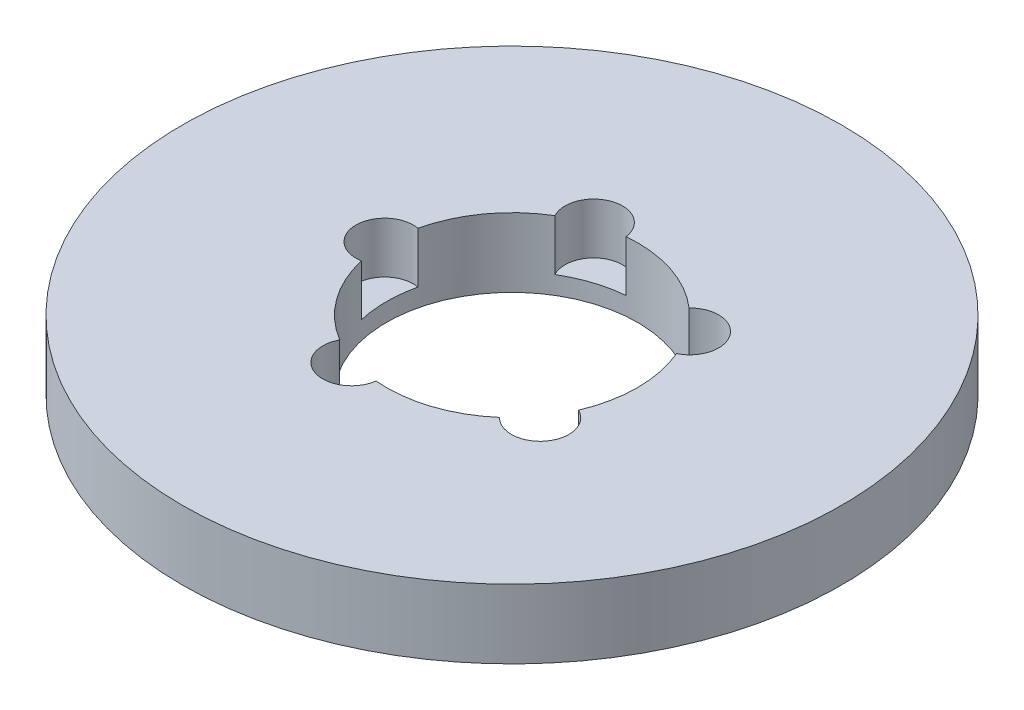
from build123d import *

# Parameters (mm, degrees)
SKETCH1_R           = 52.5
BOSS_EXTRUDE1_DEPTH = 11
SKETCH2_R           = 20
CUT_EXTRUDE1_DEPTH  = 76.056645275
SKETCH3_R           = 4.575923698
CUT_EXTRUDE2_DEPTH  = 8.123196128
CIRPATTERN1_COUNT   = 5


with BuildPart() as part:
    # Sketch1 → Boss-Extrude1 (new body)
    with BuildSketch(Plane(origin=(0, 0, 0), x_dir=(1, 0, 0), z_dir=(0, 1, 0))):
        Circle(SKETCH1_R)
    extrude(amount=BOSS_EXTRUDE1_DEPTH)

    # Sketch2 → Cut-Extrude1 (cut, through all)
    with BuildSketch(Plane(origin=(0, 0, 0), x_dir=(1, 0, 0), z_dir=(0, 1, 0))):
        Circle(SKETCH2_R)
    extrude(amount=CUT_EXTRUDE1_DEPTH, mode=Mode.SUBTRACT)

    # Sketch3 → Cut-Extrude2 (cut)
    with BuildSketch(Plane(origin=(0, 11, 0), x_dir=(1, 0, 0), z_dir=(0, 1, 0))):
        with Locations((-20.292409218, 0)):
            Circle(SKETCH3_R)
    cut_extrude2 = extrude(amount=-CUT_EXTRUDE2_DEPTH, mode=Mode.SUBTRACT)

    # CirPattern1: Cut-Extrude2 ×5 about axis
    cirpattern1_axis = Axis((0, 0, 0), (0, 1, 0))
    for i in range(1, CIRPATTERN1_COUNT):
        add(cut_extrude2.rotate(cirpattern1_axis, i * 360 / CIRPATTERN1_COUNT), mode=Mode.SUBTRACT)


solid = part.part
